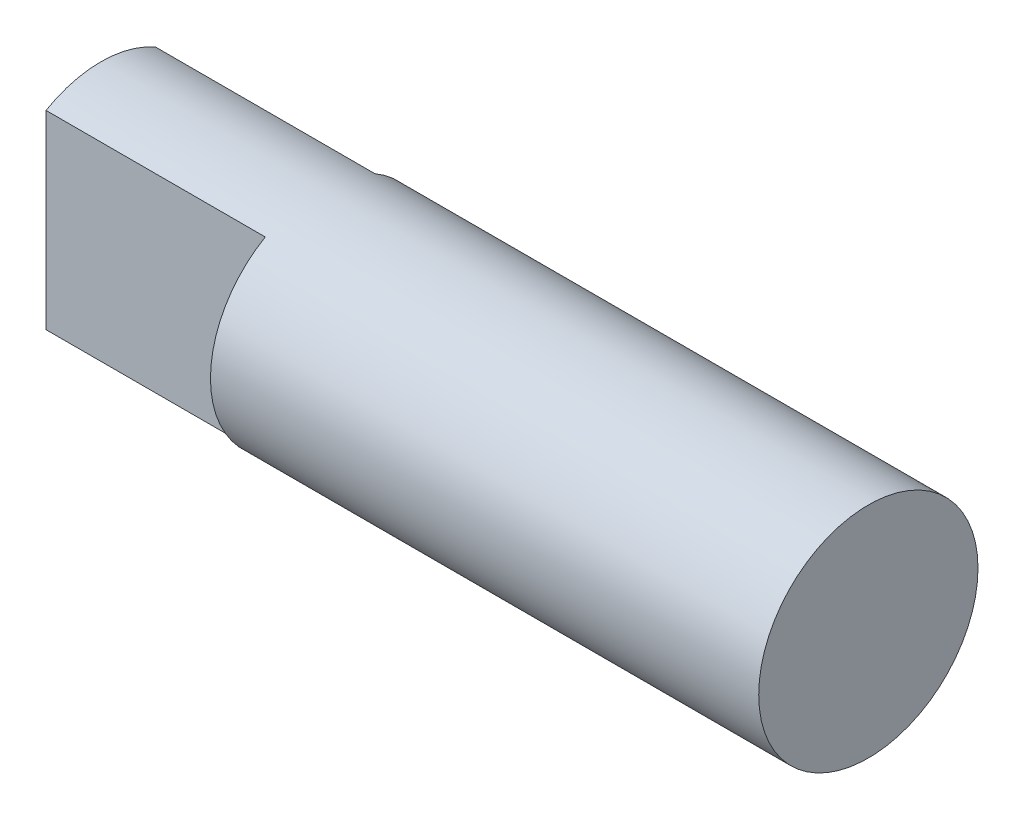
from build123d import *

# Parameters (mm, degrees)
BOSS_EXTRUDE1_DEPTH      = 76.2
BOSS_EXTRUDE1_DEPTH_BACK = 12.7
SKETCH1_R                = 12.7
CUT_EXTRUDE1_DEPTH       = 79.288057838
CUT_EXTRUDE1_DEPTH_BACK  = 79.288057838
SKETCH2_W                = 25.4
SKETCH2_H                = 6.35


with BuildPart() as part:
    # Sketch1 → Boss-Extrude1 (new, two sides: drawn at the far end of the back side and taken through both)
    with BuildSketch(Plane(origin=(0, 0, 0), x_dir=(0, 0, -1), z_dir=(1, 0, 0)).offset(-BOSS_EXTRUDE1_DEPTH_BACK)):
        Circle(SKETCH1_R)
    extrude(amount=BOSS_EXTRUDE1_DEPTH + BOSS_EXTRUDE1_DEPTH_BACK)

    # Sketch2 → Cut-Extrude1 (cut, two sides: drawn at the far end of the back side and taken through both)
    with BuildSketch(Plane(origin=(0, 0, 0), x_dir=(1, 0, 0), z_dir=(0, 1, 0)).offset(-CUT_EXTRUDE1_DEPTH_BACK)):
        with Locations((0, -9.525)):
            Rectangle(SKETCH2_W, SKETCH2_H)
        with Locations((0, 9.525)):
            Rectangle(SKETCH2_W, SKETCH2_H)
    extrude(amount=CUT_EXTRUDE1_DEPTH + CUT_EXTRUDE1_DEPTH_BACK, mode=Mode.SUBTRACT)


solid = part.part
